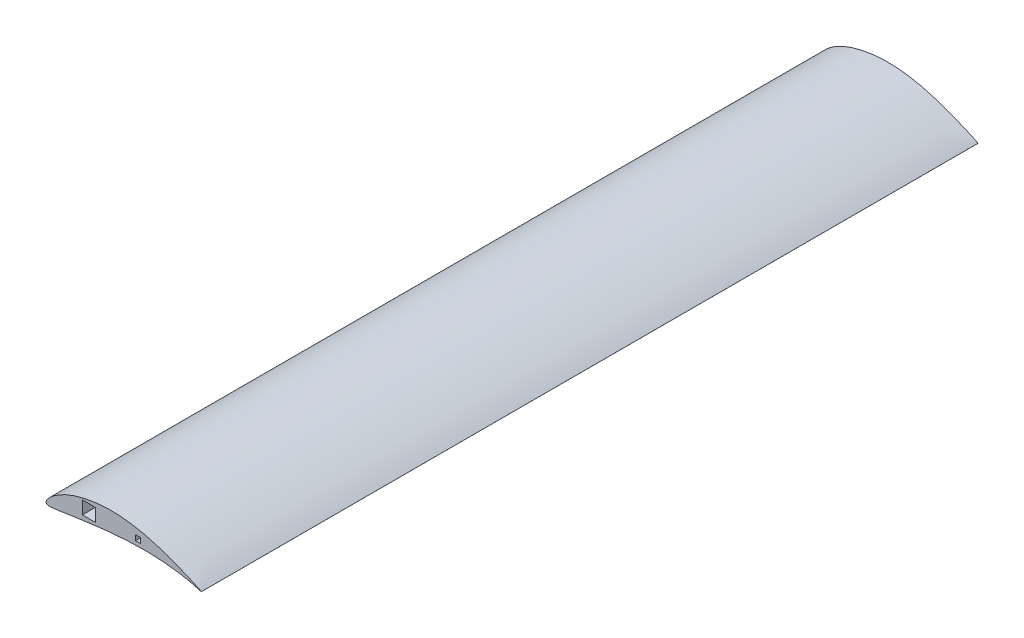
from build123d import *

# Parameters (mm, degrees)
SKETCH3_W           = 0.049362983
SKETCH3_H           = 0.049362982
SKETCH3_W_2         = 0.024681491
SKETCH3_H_2         = 0.024681492
SKETCH3_W_3         = 10
SKETCH3_H_3         = 10
SKETCH3_W_4         = 25
SKETCH3_H_4         = 25
BOSS_EXTRUDE1_DEPTH = 1500


with BuildPart() as part:
    # Sketch3 → Boss-Extrude1 (new body)
    with BuildSketch(Plane.XY):
        with BuildLine():
            Line((300, -0.018), (300, 0.015))
            add(Edge.make_bspline(
                [(300, 0.015), (299.754862186, 0.180319889), (298.848516045, 0.791555834), (296.905820396, 1.940844568), (293.846562551, 3.498119544), (289.786234956, 5.300647852), (284.81091618, 7.500970658), (278.896848113, 10.093160122), (269.235368374, 14.194181818), (258.498402845, 18.648777598), (246.758684368, 23.271603755), (237.010230395, 26.912833416), (226.749735844, 30.509867692), (212.356834838, 35.163111397), (197.522529239, 39.334646313), (182.353227236, 42.798461581), (170.853201975, 44.98301139), (159.331591846, 46.690763421), (147.82017929, 47.910045372), (136.347845343, 48.609534928), (124.958548533, 48.807103238), (113.716248614, 48.48487275), (99.148579004, 47.416559044), (84.989197502, 45.420259799), (71.374633428, 42.547676381), (61.748056885, 40.039953084), (52.621081944, 37.189912681), (44.058254452, 34.007861761), (36.116375062, 30.544956582), (28.854851854, 26.849076748), (22.32185623, 23.005051099), (16.550332438, 19.127163233), (11.571972604, 15.305964816), (7.422406451, 11.604304991), (4.122660528, 8.102946267), (1.717759869, 4.901059517), (0.33947435, 2.239212474), (-0.102376723, 0.158251074), (0.204042896, -1.585802336), (1.733702046, -3.011834921), (4.269174327, -3.6752251), (7.579250506, -3.882881475), (11.724856181, -3.646902674), (16.683612166, -3.07277679), (22.442616665, -2.246016868), (28.969311466, -1.265628508), (36.224025164, -0.197810814), (44.15113532, 0.991081194), (52.70037548, 2.273175336), (65.16584294, 4.13422544), (78.267212303, 6.012200663), (99.339439731, 8.800524446), (117.653538429, 10.890740194), (140.156929362, 12.90538658), (159.291423122, 14.217617844), (178.46609452, 14.840725332), (193.73246988, 14.83951784), (205.000701033, 14.58328475), (216.02516098, 14.062603516), (226.716356783, 13.318832132), (236.983711091, 12.374806266), (246.740426253, 11.277147863), (255.896535959, 10.033042314), (264.364958316, 8.678761763), (272.059932476, 7.24351996), (278.903943991, 5.784295144), (284.834441266, 4.34978891), (289.798469557, 2.925803483), (293.795359277, 1.632851008), (296.845206134, 0.715459418), (298.816643013, 0.216945523), (299.753762754, 0.030888323), (300, -0.018)],
                knots=[0, 0, 0, 0, 0.001413477, 0.005226038, 0.010781091, 0.017815608, 0.026460951, 0.036790889, 0.048685593, 0.076639155, 0.092362872, 0.109003461, 0.126386903, 0.144339126, 0.181312719, 0.200023431, 0.218712626, 0.237261299, 0.255692478, 0.274037197, 0.292192583, 0.310132767, 0.327788163, 0.362001934, 0.378421226, 0.394286639, 0.40954344, 0.424114253, 0.43793778, 0.450941833, 0.463044023, 0.474154417, 0.484164575, 0.493023962, 0.500713088, 0.507125739, 0.512129705, 0.514904185, 0.517171427, 0.520261618, 0.5242453, 0.529497961, 0.536092185, 0.54406114, 0.553363127, 0.563904543, 0.575614949, 0.588420092, 0.60222661, 0.616944448, 0.648675826, 0.665501113, 0.718564132, 0.736789145, 0.773513212, 0.810244924, 0.828488569, 0.846493195, 0.864125178, 0.88124851, 0.897725282, 0.913415058, 0.928184346, 0.941897285, 0.954411455, 0.965602702, 0.975349728, 0.983575522, 0.990284579, 0.99543259, 0.998799869, 1, 1, 1, 1], degree=3))
        make_face()
        with Locations((0.205080965, 0.015770824)):
            Rectangle(SKETCH3_W, SKETCH3_H, mode=Mode.SUBTRACT)
        with Locations((0.476546058, 0.01181697)):
            Rectangle(SKETCH3_W_2, SKETCH3_H_2, mode=Mode.SUBTRACT)
        with Locations((177.950642805, 26.874787095)):
            Rectangle(SKETCH3_W_3, SKETCH3_H_3, mode=Mode.SUBTRACT)
        with Locations((82.780238575, 26.220217403)):
            Rectangle(SKETCH3_W_4, SKETCH3_H_4, mode=Mode.SUBTRACT)
    extrude(amount=BOSS_EXTRUDE1_DEPTH)


solid = part.part
